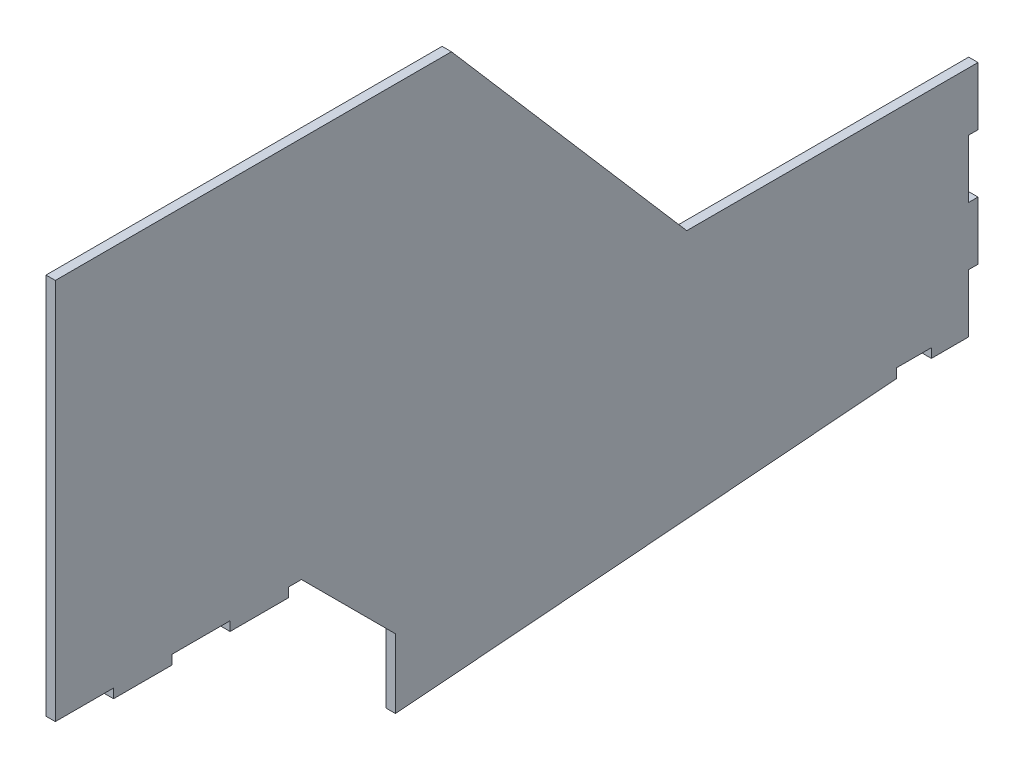
from build123d import *

# Parameters (mm, degrees)
SALIENTE_EXTRUIR1_DEPTH = 4
CROQUIS3_W              = 4
CROQUIS3_H              = 25
CORTAR_EXTRUIR1_DEPTH   = 10
SALIENTE_EXTRUIR2_DEPTH = 4
CROQUIS5_W              = 15
CROQUIS5_H              = 4
CORTAR_EXTRUIR2_DEPTH   = 10


with BuildPart() as part:
    # Croquis2 → Saliente-Extruir1 (new body)
    with BuildSketch(Plane(origin=(0, 0, 0), x_dir=(0, 0, -1), z_dir=(1, 0, 0))):
        Polygon((-196, 89), (-196, -75), (-90.353418897, -75), (-50, -115.353418897), (-50, -145), (165, -128), (200, -128), (200, -28), (75, -28), (-26, 89), align=None)
    extrude(amount=SALIENTE_EXTRUIR1_DEPTH)

    # Croquis3 → Cortar-Extruir1 (cut)
    with BuildSketch(Plane(origin=(4, 0, 0), x_dir=(0, 0, -1), z_dir=(1, 0, 0))):
        with Locations((198, -65.5)):
            Rectangle(CROQUIS3_W, CROQUIS3_H)
        with Locations((198, -115.5)):
            Rectangle(CROQUIS3_W, CROQUIS3_H)
    extrude(amount=-CORTAR_EXTRUIR1_DEPTH, mode=Mode.SUBTRACT)

    # Croquis4 → Saliente-Extruir2 (add)
    with BuildSketch(Plane(origin=(4, 0, 0), x_dir=(0, 0, -1), z_dir=(1, 0, 0))):
        Polygon((-196, -75), (-171, -75), (-171, -79), (-146, -79), (-146, -75), (-121, -75), (-121, -79), (-96, -79), (-96, -75), (-71, -75), (-71, -79), (-46, -79), (-46, -75), (-21, -75), (-21, -79), (4, -79), (4, -43.966541651), (4, -42.504718563), (-196, -42.504718563), align=None)
    extrude(amount=-SALIENTE_EXTRUIR2_DEPTH)

    # Croquis5 → Cortar-Extruir2 (cut)
    with BuildSketch(Plane(origin=(4, 0, 0), x_dir=(0, 0, -1), z_dir=(1, 0, 0))):
        with Locations((172.5, -126)):
            Rectangle(CROQUIS5_W, CROQUIS5_H)
    extrude(amount=-CORTAR_EXTRUIR2_DEPTH, mode=Mode.SUBTRACT)


solid = part.part
